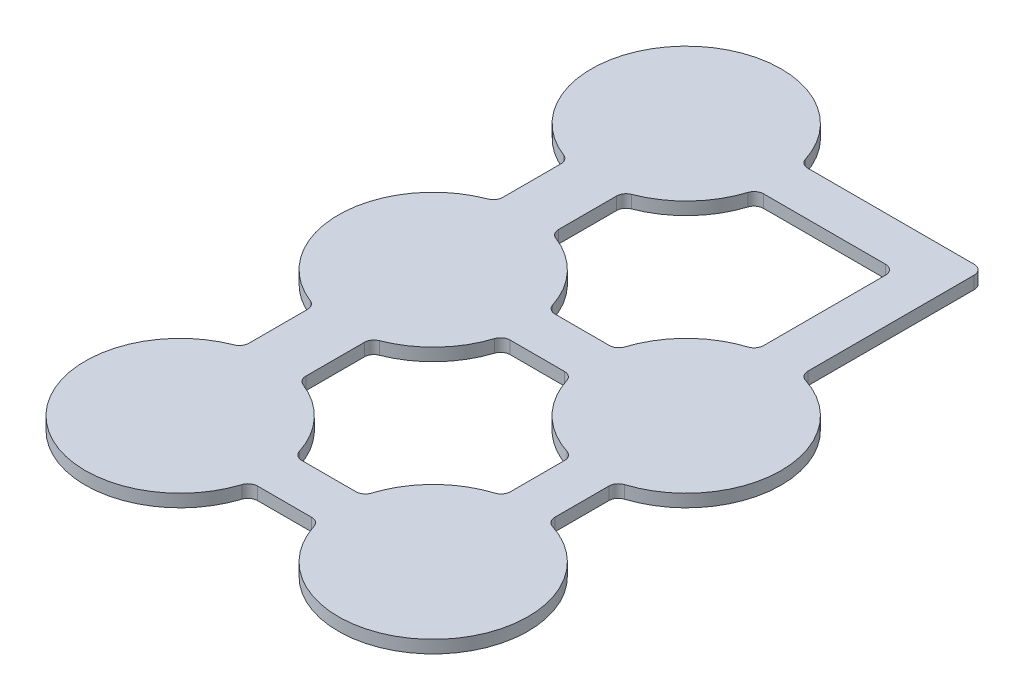
from build123d import *

# Parameters (mm, degrees)
BOSS_EXTRUDE1_DEPTH = 1
FILLET1_R           = 0.75


with BuildPart() as part:
    # Sketch1 → Boss-Extrude1 (new body)
    with BuildSketch(Plane(origin=(0, 0, 0), x_dir=(1, 0, 0), z_dir=(0, 1, 0))):
        with BuildLine():
            ThreePointArc((-2.707023927, 21.75), (-15.135809911, 25.465661585), (-12.2, 12.829923292))
            Line((-12.2, 12.829923292), (-12.2, 7.170076708))
            ThreePointArc((-12.2, 7.170076708), (-17.499954312, 0.026178544), (-12.25, -7.154544011))
            Line((-12.25, -7.154544011), (-12.25, -12.845455989))
            ThreePointArc((-12.25, -12.845455989), (-15.116700883, -25.483554693), (-2.707023927, -21.75))
            Line((-2.707023927, -21.75), (2.707023927, -21.75))
            ThreePointArc((2.707023927, -21.75), (15.303300859, -25.303300859), (11.75, -12.707023927))
            Line((11.75, -12.707023927), (11.75, -7.292976073))
            ThreePointArc((11.75, -7.292976073), (17.5, 0), (11.75, 7.292976073))
            Line((11.75, 7.292976073), (11.75, 21.75))
            Line((11.75, 21.75), (-2.707023927, 21.75))
        make_face()
        with BuildLine():
            ThreePointArc((-7.8, 12.829923292), (-4.534338415, 14.864190089), (-2.707023927, 18.25))
            Line((-2.707023927, 18.25), (8.25, 18.25))
            Line((8.25, 18.25), (8.25, 7.292976073))
            ThreePointArc((8.25, 7.292976073), (4.705800433, 5.312386558), (2.713068204, 1.775))
            Line((2.713068204, 1.775), (-2.713068204, 1.775))
            ThreePointArc((-2.713068204, 1.775), (-4.543152751, 5.145174254), (-7.8, 7.170076708))
            Line((-7.8, 7.170076708), (-7.8, 12.829923292))
        make_face(mode=Mode.SUBTRACT)
        with BuildLine():
            ThreePointArc((-7.75, -7.154544011), (-4.525226903, -5.126095935), (-2.713068204, -1.775))
            Line((-2.713068204, -1.775), (2.713068204, -1.775))
            ThreePointArc((2.713068204, -1.775), (4.705800433, -5.312386558), (8.25, -7.292976073))
            Line((8.25, -7.292976073), (8.25, -12.707023927))
            ThreePointArc((8.25, -12.707023927), (4.696699141, -14.696699141), (2.707023927, -18.25))
            Line((2.707023927, -18.25), (-2.707023927, -18.25))
            ThreePointArc((-2.707023927, -18.25), (-4.516445307, -14.883299117), (-7.75, -12.845455989))
            Line((-7.75, -12.845455989), (-7.75, -7.154544011))
        make_face(mode=Mode.SUBTRACT)
    extrude(amount=BOSS_EXTRUDE1_DEPTH)

    # Fillet1
    fillet1_edges = [part.edges().sort_by_distance(p)[0] for p in [
        (2.713068204, 0.5, -1.775),
        (-2.713068204, 0.5, -1.775),
        (11.75, 0.5, -21.75),
        (-2.707023927, 0.5, -21.75),
        (8.25, 0.5, -7.292976073),
        (11.75, 0.5, -7.292976073),
        (11.75, 0.5, 12.707023927),
        (2.707023927, 0.5, 21.75),
        (-2.707023927, 0.5, 21.75),
        (-2.707023927, 0.5, 18.25),
        (2.707023927, 0.5, 18.25),
        (8.25, 0.5, 12.707023927),
        (11.75, 0.5, 7.292976073),
        (-2.713068204, 0.5, 1.775),
        (2.713068204, 0.5, 1.775),
        (8.25, 0.5, 7.292976073),
        (-12.25, 0.5, 12.845455989),
        (-7.75, 0.5, 12.845455989),
        (-7.75, 0.5, 7.154544011),
        (-12.25, 0.5, 7.154544011),
        (-12.2, 0.5, -7.170076708),
        (-7.8, 0.5, -7.170076708),
        (8.25, 0.5, -18.25),
        (-2.707023927, 0.5, -18.25),
        (-7.8, 0.5, -12.829923292),
        (-12.2, 0.5, -12.829923292),
    ]]
    fillet(fillet1_edges, radius=FILLET1_R)


solid = part.part
